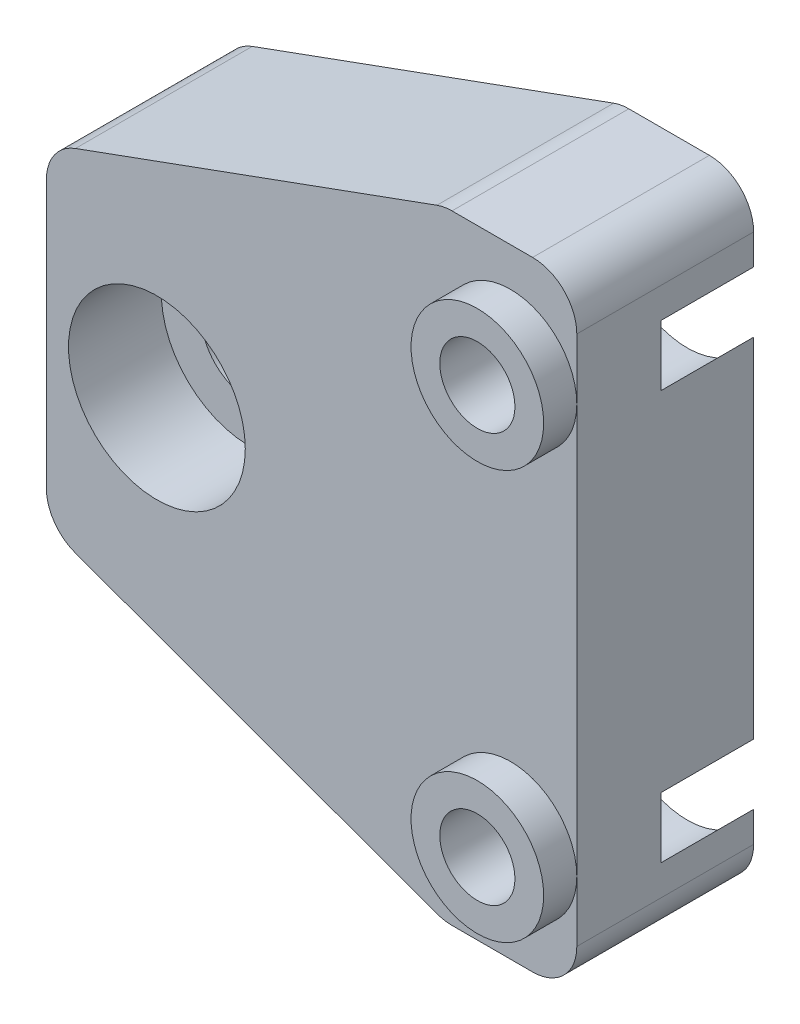
from build123d import *
from OCP.BRepFilletAPI import BRepFilletAPI_MakeChamfer

# Parameters (mm, degrees)
ESQUISSE1_W             = 24
ESQUISSE1_H             = 28
BOSS_EXTRU_1_DEPTH      = 8
ESQUISSE2_R             = 2.2
ENL_V_MAT_EXTRU_1_DEPTH = 23.715633383
ESQUISSE3_R             = 4
ENL_V_MAT_EXTRU_2_DEPTH = 4.2
ESQUISSE4_R             = 1.7
ENL_V_MAT_EXTRU_3_DEPTH = 23.715633383
ESQUISSE5_R             = 3.3
ENL_V_MAT_EXTRU_6_DEPTH = 4.2
BOSS_EXTRU_2_START      = -1
ESQUISSE6_R             = 1.7
BOSS_EXTRU_2_DEPTH      = 1
CHANFREIN1_SIZE         = 18
CHANFREIN1_SIZE2        = 6.551464217
CONG_1_R                = 2
BOSS_EXTRU_3_START      = 1.5
ESQUISSE7_R             = 3
ESQUISSE7_R_2           = 1.7
BOSS_EXTRU_3_DEPTH      = 1.5


with BuildPart() as part:
    # Esquisse1 → Boss.-Extru.1 (new body)
    with BuildSketch(Plane.XY):
        with Locations((4, 0)):
            Rectangle(ESQUISSE1_W, ESQUISSE1_H)
    extrude(amount=BOSS_EXTRU_1_DEPTH)

    # Esquisse2 → Enlèv. mat.-Extru.1 (cut, through all)
    with BuildSketch(Plane.XY.offset(8)):
        with Locations((-3, 0)):
            Circle(ESQUISSE2_R)
    extrude(amount=-ENL_V_MAT_EXTRU_1_DEPTH, mode=Mode.SUBTRACT)

    # Esquisse3 → Enlèv. mat.-Extru.2 (cut)
    with BuildSketch(Plane.XY.offset(8)):
        with Locations((-3, 0)):
            Circle(ESQUISSE3_R)
    extrude(amount=-ENL_V_MAT_EXTRU_2_DEPTH, mode=Mode.SUBTRACT)

    # Esquisse4 → Enlèv. mat.-Extru.3 (cut, through all)
    with BuildSketch(Plane.XY.offset(8)):
        with Locations((13, 9.25)):
            Circle(ESQUISSE4_R)
        with Locations((13, -9.25)):
            Circle(ESQUISSE4_R)
    extrude(amount=-ENL_V_MAT_EXTRU_3_DEPTH, mode=Mode.SUBTRACT)

    # Esquisse5 → Enlèv. mat.-Extru.6 (cut)
    with BuildSketch(Plane(origin=(0, 0, 0), x_dir=(-1, 0, 0), z_dir=(0, 0, -1))):
        with Locations((-13, 9.25)):
            Circle(ESQUISSE5_R)
        with Locations((-13, -9.25)):
            Circle(ESQUISSE5_R)
    extrude(amount=-ENL_V_MAT_EXTRU_6_DEPTH, mode=Mode.SUBTRACT)

    # Esquisse6 → Boss.-Extru.2 (add)
    with BuildSketch(Plane(origin=(0, 0, 4.2), x_dir=(-1, 0, 0), z_dir=(0, 0, -1)).offset(BOSS_EXTRU_2_START)):
        with Locations((-13, 9.25)):
            Circle(ESQUISSE6_R)
        with Locations((-13, -9.25)):
            Circle(ESQUISSE6_R)
    extrude(amount=BOSS_EXTRU_2_DEPTH)

    # Chanfrein1: one chamfer whose edges measure the first distance from different faces: ONE call of the kernel's chamfer builder (chamfer() names one face for all edges)
    chanfrein1_edges_1 = [part.edges().sort_by_distance(p)[0] for p in [
        (-8, -14, 4),
    ]]
    chanfrein1_side_1 = [part.faces().sort_by_distance(p)[0] for p in [
        (4, -14, 4),
    ]]
    chanfrein1_edges_2 = [part.edges().sort_by_distance(p)[0] for p in [
        (-8, 14, 4),
    ]]
    chanfrein1_side_2 = [part.faces().sort_by_distance(p)[0] for p in [
        (4, 14, 4),
    ]]
    chanfrein1 = BRepFilletAPI_MakeChamfer(part.part.solid().wrapped)
    for e in chanfrein1_edges_1:
        chanfrein1.Add(CHANFREIN1_SIZE, CHANFREIN1_SIZE2, e.wrapped, chanfrein1_side_1[0].wrapped)  # the first distance lies on this face
    for e in chanfrein1_edges_2:
        chanfrein1.Add(CHANFREIN1_SIZE, CHANFREIN1_SIZE2, e.wrapped, chanfrein1_side_2[0].wrapped)  # the first distance lies on this face
    add(Compound.cast(chanfrein1.Shape()), mode=Mode.REPLACE)

    # Congé1
    cong_1_edges = [part.edges().sort_by_distance(p)[0] for p in [
        (10, -14, 4),
        (16, -14, 4),
        (16, 14, 4),
        (10, 14, 4),
        (-8, -7.448535783, 4),
        (-8, 7.448535783, 4),
    ]]
    fillet(cong_1_edges, radius=CONG_1_R)

    # Esquisse7 → Boss.-Extru.3 (add)
    # profile 1 of 2: a face of its own
    with BuildSketch(Plane.XY.offset(8).offset(BOSS_EXTRU_3_START)):
        with Locations((13, -9.25)):
            Circle(ESQUISSE7_R)
        with Locations((13, -9.25)):
            Circle(ESQUISSE7_R_2, mode=Mode.SUBTRACT)
    # profile 2 of 2: a face of its own
    with BuildSketch(Plane.XY.offset(8).offset(BOSS_EXTRU_3_START)):
        with Locations((13, 9.25)):
            Circle(ESQUISSE7_R)
        with Locations((13, 9.25)):
            Circle(ESQUISSE7_R_2, mode=Mode.SUBTRACT)
    extrude(amount=-BOSS_EXTRU_3_DEPTH)


solid = part.part
